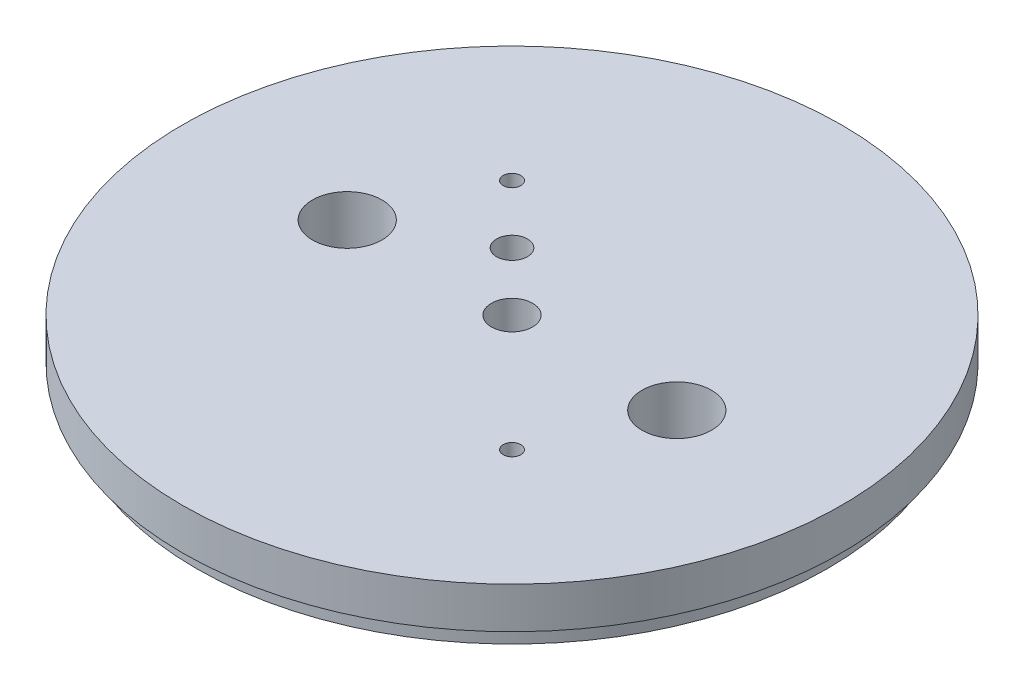
from build123d import *

# Parameters (mm, degrees)
SKETCH1_R           = 50.8
SKETCH1_R_2         = 3.175
SKETCH1_R_3         = 5.3578125
SKETCH1_R_4         = 1.3589
SKETCH1_R_5         = 2.38125
BOSS_EXTRUDE1_DEPTH = 9.525
SKETCH2_R           = 50.8
SKETCH2_R_2         = 48.641
CUT_EXTRUDE1_DEPTH  = 3.175
CUT_EXTRUDE2_START  = -5.969
CUT_EXTRUDE2_DEPTH  = 3.556


with BuildPart() as part:
    # Sketch1 → Boss-Extrude1 (new body)
    with BuildSketch(Plane(origin=(0, 0, 0), x_dir=(1, 0, 0), z_dir=(0, 1, 0))):
        Circle(SKETCH1_R)
        Circle(SKETCH1_R_2, mode=Mode.SUBTRACT)
        with Locations((25.4, 0)):
            Circle(SKETCH1_R_3, mode=Mode.SUBTRACT)
        with Locations((-25.4, 0)):
            Circle(SKETCH1_R_3, mode=Mode.SUBTRACT)
        with Locations((-17.960512242, 17.960512242)):
            Circle(SKETCH1_R_4, mode=Mode.SUBTRACT)
        with Locations((17.960512242, -17.960512242)):
            Circle(SKETCH1_R_4, mode=Mode.SUBTRACT)
        with Locations((-8.980256121, 8.980256121)):
            Circle(SKETCH1_R_5, mode=Mode.SUBTRACT)
    extrude(amount=BOSS_EXTRUDE1_DEPTH)

    # Sketch2 → Cut-Extrude1 (cut)
    with BuildSketch(Plane.XZ):
        Circle(SKETCH2_R)
        Circle(SKETCH2_R_2, mode=Mode.SUBTRACT)
    extrude(amount=-CUT_EXTRUDE1_DEPTH, mode=Mode.SUBTRACT)

    # Sketch3 → Cut-Extrude2 (cut)
    with BuildSketch(Plane(origin=(0, 9.525, 0), x_dir=(1, 0, 0), z_dir=(0, 1, 0)).offset(CUT_EXTRUDE2_START)):
        with BuildLine():
            Line((3.2385, 34.798), (3.2385, 13.97))
            ThreePointArc((3.2385, 13.97), (0, 10.7315), (-3.2385, 13.97))
            Line((-3.2385, 13.97), (-3.2385, 34.798))
            ThreePointArc((-3.2385, 34.798), (0, 38.0365), (3.2385, 34.798))
        make_face()
        with BuildLine():
            Line((3.2385, -34.798), (3.2385, -13.97))
            ThreePointArc((3.2385, -13.97), (0, -10.7315), (-3.2385, -13.97))
            Line((-3.2385, -13.97), (-3.2385, -34.798))
            ThreePointArc((-3.2385, -34.798), (0, -38.0365), (3.2385, -34.798))
        make_face()
    extrude(amount=-CUT_EXTRUDE2_DEPTH, mode=Mode.SUBTRACT)


solid = part.part
